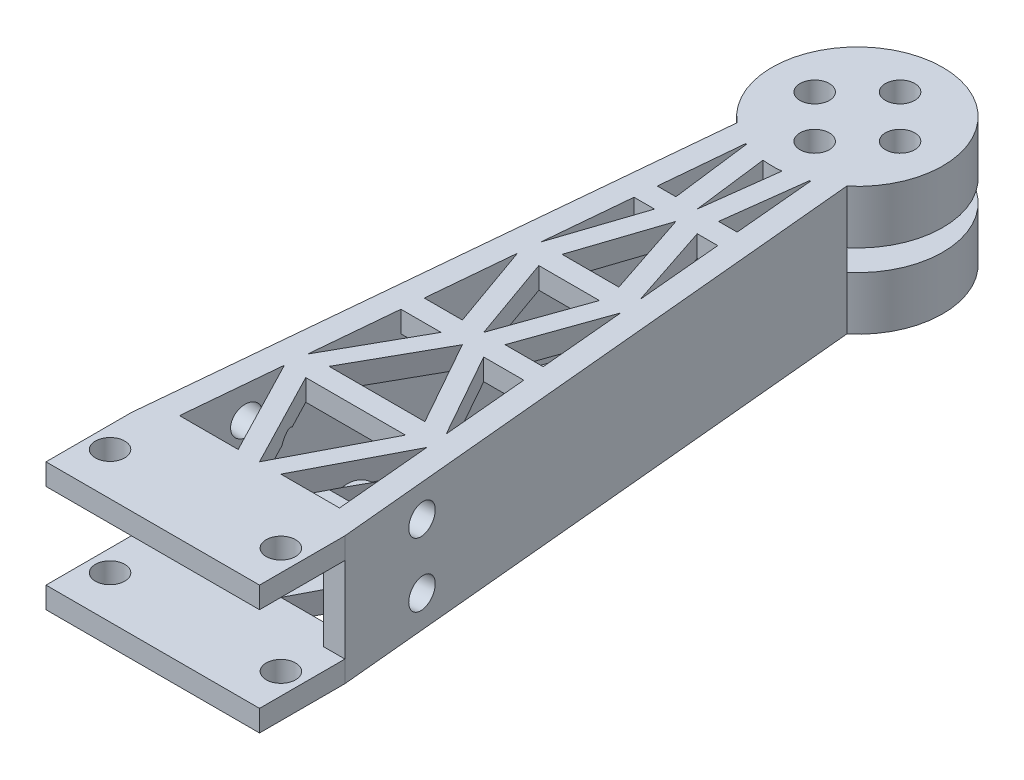
from build123d import *

# Parameters (mm, degrees)
BOSS_EXTRUDE1_DEPTH = 19.05
SKETCH2_W           = 31.75
SKETCH2_H           = 12.7
CUT_EXTRUDE1_DEPTH  = 12.7
CUT_EXTRUDE2_START  = -3.175
CUT_EXTRUDE2_DEPTH  = 12.7
CUT_EXTRUDE8_DEPTH  = 121.147638345
SKETCH7_R           = 2.1828125
CUT_EXTRUDE9_DEPTH  = 121.147638345
SKETCH8_W           = 25.4
SKETCH8_H           = 12.7
CUT_EXTRUDE10_DEPTH = 3.175
SKETCH15_R          = 12.7
BOSS_EXTRUDE4_DEPTH = 19.05
CUT_EXTRUDE14_REACH = 122.498
SKETCH16_R          = 2.1828125
MIRROR2_START       = -1.185427
MIRROR2_DEPTH       = 22.423272137
CUT_EXTRUDE15_START = -7.9375
SKETCH17_R          = 12.7
CUT_EXTRUDE15_DEPTH = 3.175
SKETCH18_R          = 2.1828125
CUT_EXTRUDE16_DEPTH = 124.171996107


# Read off the part's stored shape, not the designer's step: Mirror2
with BuildPart() as part:
    # Sketch1 → Boss-Extrude1 (new body)
    with BuildSketch(Plane(origin=(0, 0, 0), x_dir=(1, 0, 0), z_dir=(0, 1, 0))):
        Polygon((0, 0), (31.75, 0), (31.75, 12.7), (22.225, 114.3), (9.525, 114.3), (0, 12.7), align=None)
    extrude(amount=BOSS_EXTRUDE1_DEPTH)

    # Sketch2 → Cut-Extrude1 (cut)
    with BuildSketch(Plane.XY):
        with Locations((15.875, 9.525)):
            Rectangle(SKETCH2_W, SKETCH2_H)
    extrude(amount=-CUT_EXTRUDE1_DEPTH, mode=Mode.SUBTRACT)

    # Sketch3 → Cut-Extrude2 (cut)
    with BuildSketch(Plane(origin=(0, 19.05, 0), x_dir=(1, 0, 0), z_dir=(0, 1, 0)).offset(CUT_EXTRUDE2_START)):
        Polygon((27.770100375, 15.875), (3.979899625, 15.875), (12.7, 111.125), (19.05, 111.125), align=None)
    extrude(amount=-CUT_EXTRUDE2_DEPTH, mode=Mode.SUBTRACT)

    # Sketch6 → Cut-Extrude8 (cut, through all)
    with BuildSketch(Plane(origin=(0, 19.05, 0), x_dir=(1, 0, 0), z_dir=(0, 1, 0))):
        Polygon((3.979899625, 15.875), (12.7, 15.875), (5.287914682, 30.1625), align=None)
        Polygon((15.875, 15.875), (8.462914682, 30.1625), (23.287085318, 30.1625), align=None)
        Polygon((19.05, 15.875), (27.770100375, 15.875), (26.462085318, 30.1625), align=None)
        Polygon((8.753584694, 33.3375), (22.996415306, 33.3375), (15.875, 46.0375), align=None)
        Polygon((6.741264744, 46.0375), (5.578584694, 33.3375), (12.7, 46.0375), align=None)
        Polygon((19.05, 46.0375), (26.171415306, 33.3375), (25.008735256, 46.0375), align=None)
        Polygon((19.05, 49.2125), (24.718065243, 49.2125), (23.555385194, 61.9125), align=None)
        Polygon((8.194614806, 61.9125), (7.031934757, 49.2125), (12.7, 49.2125), align=None)
        Polygon((15.875, 49.2125), (11.369614806, 61.9125), (20.380385194, 61.9125), align=None)
        Polygon((11.660284819, 65.0875), (20.089715181, 65.0875), (15.875, 77.7875), align=None)
        Polygon((9.647964869, 77.7875), (8.485284819, 65.0875), (12.7, 77.7875), align=None)
        Polygon((19.05, 77.7875), (23.264715181, 65.0875), (22.102035131, 77.7875), align=None)
        Polygon((11.101314931, 93.6625), (9.938634881, 80.9625), (12.7, 80.9625), align=None)
        Polygon((15.875, 80.9625), (14.276314931, 93.6625), (17.473685069, 93.6625), align=None)
        Polygon((19.05, 80.9625), (21.811365119, 80.9625), (20.648685069, 93.6625), align=None)
    extrude(amount=-CUT_EXTRUDE8_DEPTH, mode=Mode.SUBTRACT)

    # Sketch7 → Cut-Extrude9 (cut, through all)
    with BuildSketch(Plane(origin=(0, 19.05, 0), x_dir=(1, 0, 0), z_dir=(0, 1, 0))):
        with Locations(Location((3.175, 6.35, 0), (0, 0, 270))):
            Circle(SKETCH7_R)
        with Locations(Location((28.575, 6.35, 0), (0, 0, 270))):
            Circle(SKETCH7_R)
    extrude(amount=-CUT_EXTRUDE9_DEPTH, mode=Mode.SUBTRACT)

    # Sketch8 → Cut-Extrude10 (cut)
    with BuildSketch(Plane.XY.offset(-12.7)):
        with Locations((15.875, 9.525)):
            Rectangle(SKETCH8_W, SKETCH8_H)
    extrude(amount=-CUT_EXTRUDE10_DEPTH, mode=Mode.SUBTRACT)

    # Sketch15 → Boss-Extrude4 (add)
    with BuildSketch(Plane(origin=(0, 19.05, 0), x_dir=(1, 0, 0), z_dir=(0, 1, 0))):
        with Locations((15.875, 104.775)):
            Circle(SKETCH15_R)
    extrude(amount=-BOSS_EXTRUDE4_DEPTH)

    # Cut-Extrude14: up to this plane
    cut_extrude14_end = Plane(origin=(27.770100375, 3.175, -15.875), z_dir=(0.9958354943014712, 0, -0.09116835135804853))
    # Sketch16 → Cut-Extrude14 (cut, up to the surface)
    with BuildSketch(Plane(origin=(32.653630203, 0, -3.061277832), x_dir=(-0.09334070869305827, 0, -0.9956342260592882), z_dir=(0.9956342260592881, 0, -0.09334070869305826)), mode=Mode.PRIVATE) as cut_extrude14_sk1:
        with Locations((22.38098717, 14.2875)):
            Circle(SKETCH16_R)
    cut_extrude14_tool1 = split(extrude(cut_extrude14_sk1.sketch, amount=-CUT_EXTRUDE14_REACH, mode=Mode.PRIVATE), bisect_by=cut_extrude14_end, keep=Keep.BOTH, mode=Mode.PRIVATE)
    add(cut_extrude14_tool1.solids().sort_by_distance((30.564573, 14.2875, -25.344555))[0], mode=Mode.SUBTRACT)
    # Sketch16 → Cut-Extrude14 (cut, up to the surface)
    with BuildSketch(Plane(origin=(32.653630203, 0, -3.061277832), x_dir=(-0.09334070869305827, 0, -0.9956342260592882), z_dir=(0.9956342260592881, 0, -0.09334070869305826)), mode=Mode.PRIVATE) as cut_extrude14_sk2:
        with Locations((22.38098717, 4.7625)):
            Circle(SKETCH16_R)
    cut_extrude14_tool2 = split(extrude(cut_extrude14_sk2.sketch, amount=-CUT_EXTRUDE14_REACH, mode=Mode.PRIVATE), bisect_by=cut_extrude14_end, keep=Keep.BOTH, mode=Mode.PRIVATE)
    add(cut_extrude14_tool2.solids().sort_by_distance((30.564573, 4.7625, -25.344555))[0], mode=Mode.SUBTRACT)

    # Mirror2 outline → Mirror2 (cut)
    with BuildSketch(Plane(origin=(0, 0, 0), x_dir=(0, 1, 0), z_dir=(0.9956342260592882, 0, 0.09334070869305822)).offset(MIRROR2_START)):
        with BuildLine():
            ThreePointArc((15.875, -26.842724942), (16.4703125, -25.344554671), (15.875, -23.8463844))
            ThreePointArc((15.875, -23.8463844), (12.1046875, -25.344554671), (15.875, -26.842724942))
        make_face()
        with BuildLine():
            ThreePointArc((3.175, -23.8463844), (2.5796875, -25.344554671), (3.175, -26.842724942))
            ThreePointArc((3.175, -26.842724942), (6.9453125, -25.344554671), (3.175, -23.8463844))
        make_face()
    extrude(amount=MIRROR2_DEPTH, mode=Mode.SUBTRACT)

    # Sketch17 → Cut-Extrude15 (cut)
    with BuildSketch(Plane(origin=(0, 19.05, 0), x_dir=(1, 0, 0), z_dir=(0, 1, 0)).offset(CUT_EXTRUDE15_START)):
        with Locations((15.875, 104.775)):
            Circle(SKETCH17_R)
    extrude(amount=-CUT_EXTRUDE15_DEPTH, mode=Mode.SUBTRACT)

    # Sketch18 → Cut-Extrude16 (cut, through all)
    with BuildSketch(Plane(origin=(0, 19.05, 0), x_dir=(1, 0, 0), z_dir=(0, 1, 0))):
        with Locations(Location((22.225, 104.775, 0), (0, 0, 270))):
            Circle(SKETCH18_R)
        with Locations(Location((9.525, 104.775, 0), (0, 0, 270))):
            Circle(SKETCH18_R)
        with Locations(Location((15.875, 98.425, 0), (0, 0, 270))):
            Circle(SKETCH18_R)
        with Locations(Location((15.875, 111.125, 0), (0, 0, 270))):
            Circle(SKETCH18_R)
    extrude(amount=-CUT_EXTRUDE16_DEPTH, mode=Mode.SUBTRACT)


solid = part.part
